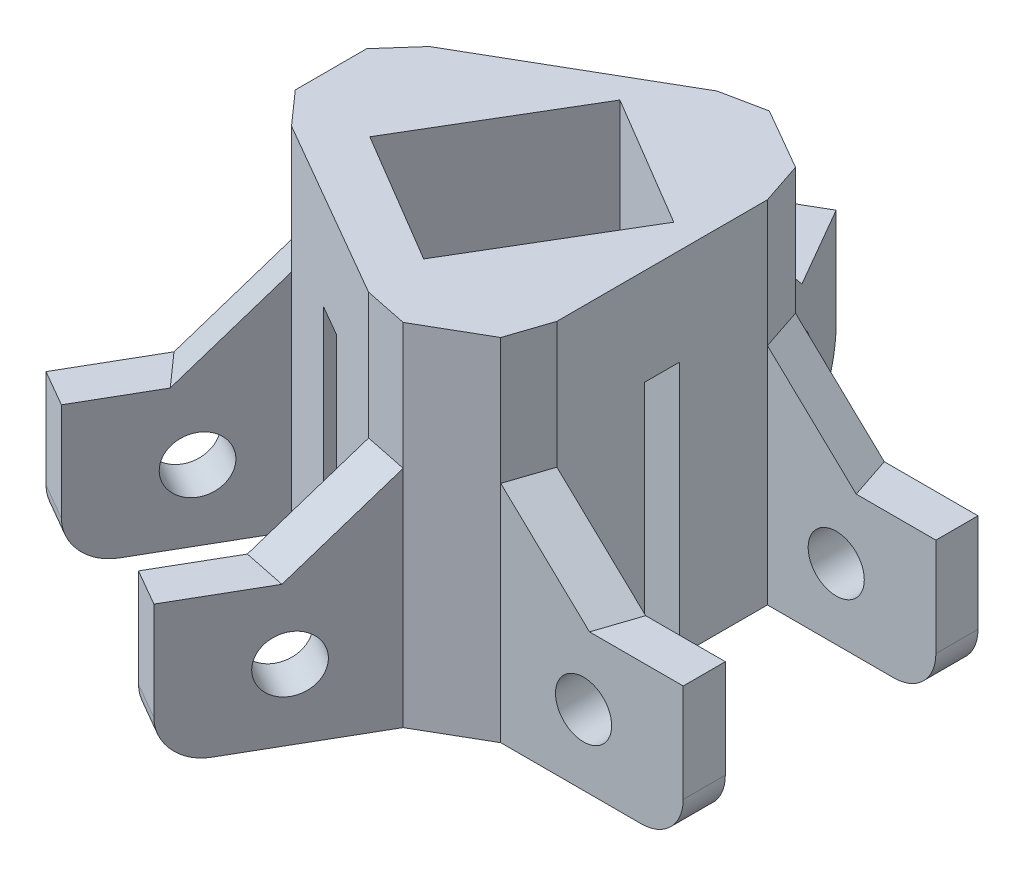
from build123d import *

# Parameters (mm, degrees)
SKETCH1_R           = 3.5
BOSS_EXTRUDE1_DEPTH = 5
SKETCH2_R           = 2
CUT_EXTRUDE1_DEPTH  = 12.5
BOSS_EXTRUDE2_DEPTH = 15
CHAMFER1_SIZE       = 6
FILLET1_R           = 3
SKETCH6_R           = 14
CUT_EXTRUDE2_DEPTH  = 1.25
CIRPATTERN1_COUNT   = 3


with BuildPart() as part:
    # Sketch1 → Boss-Extrude1 (new, symmetric)
    with BuildSketch(Plane(origin=(0, 0, 0), x_dir=(1, 0, 0), z_dir=(0, 1, 0))):
        Polygon((10, 7.5), (10, -7.5), (22, -7.5), (22, -10.5), (9, -10.5), (4.59326674, -13.044228634), (-1.90673326, -24.302558883), (-4.504809472, -22.802558883), (1.495190528, -12.410254038), (-11.495190528, -4.910254038), (-17.495190528, -15.302558883), (-20.09326674, -13.802558883), (-13.59326674, -2.544228634), (-13.59326674, 2.544228634), (-20.09326674, 13.802558883), (-17.495190528, 15.302558883), (-11.495190528, 4.910254038), (1.495190528, 12.410254038), (-4.504809472, 22.802558883), (-1.90673326, 24.302558883), (4.59326674, 13.044228634), (9, 10.5), (22, 10.5), (22, 7.5), align=None)
        with Locations(Location((0, 0, 0), (0, 0, 270))):
            Circle(SKETCH1_R, mode=Mode.SUBTRACT)
    extrude(amount=BOSS_EXTRUDE1_DEPTH, both=True)

    # Sketch2 → Cut-Extrude1 (cut, symmetric)
    with BuildSketch(Plane(origin=(6.062177826, 0, 0), x_dir=(1, 0, 0), z_dir=(0, 0, 1))):
        with Locations((8.837822174, 0)):
            Circle(SKETCH2_R)
    cut_extrude1 = extrude(amount=CUT_EXTRUDE1_DEPTH, both=True, mode=Mode.SUBTRACT)

    # Sketch5 → Boss-Extrude2 (add)
    with BuildSketch(Plane(origin=(0, 5, 0), x_dir=(1, 0, 0), z_dir=(0, 1, 0))):
        Polygon((-11.495190528, 4.910254038), (-13.59326674, 2.544228634), (-13.59326674, -2.544228634), (-11.495190528, -4.910254038), (1.495190528, -12.410254038), (4.59326674, -13.044228634), (9, -10.5), (10, -7.5), (10, 7.5), (9, 10.5), (4.59326674, 13.044228634), (1.495190528, 12.410254038), align=None)
        Polygon((-1.408058794, 8.397462142), (8.048577071, 2.778562062), (1.408058794, -8.397462142), (-8.048577071, -2.778562062), align=None, mode=Mode.SUBTRACT)
    extrude(amount=BOSS_EXTRUDE2_DEPTH)

    # Chamfer1
    # the kernel refuses this chamfer: 6 mm, written as the material it adds along each edge
    with BuildSketch(Plane(origin=(14.879425397, 5, 7.138276191), x_dir=(0.9483246169389857, -0.027495876610586355, -0.31610820564632863), z_dir=(-0.31622776601683794, 0, -0.9486832980505138))) as chamfer1_piece_1_section:
        Polygon((CHAMFER1_SIZE * 0.999621916911, -CHAMFER1_SIZE * 0.0274958766106), (-CHAMFER1_SIZE * 0.0274958766106, -CHAMFER1_SIZE * 0.999621916911), (0, 0), align=None)
    chamfer1_piece_1 = extrude(amount=34.022473516, mode=Mode.PRIVATE)
    chamfer1_piece_1 = split(chamfer1_piece_1, bisect_by=Plane(origin=(10, 7.238305373, -8.343587756), z_dir=(1, 0, 0)), keep=Keep.TOP, mode=Mode.PRIVATE)
    chamfer1_piece_1 = split(chamfer1_piece_1, bisect_by=Plane(origin=(11.214187952, 7.238305373, -7.5), z_dir=(0, 0, -1)), keep=Keep.TOP, mode=Mode.PRIVATE)
    chamfer1_piece_1 = split(chamfer1_piece_1, bisect_by=Plane(origin=(11.594394856, 7.238305373, -9.002125431), z_dir=(-0.5000000000000008, 0, 0.8660254037844383)), keep=Keep.TOP, mode=Mode.PRIVATE)
    add(chamfer1_piece_1)
    with BuildSketch(Plane(origin=(14.879425397, 5, 7.138276191), x_dir=(0.9483246169389857, -0.027495876610586355, -0.31610820564632863), z_dir=(-0.31622776601683794, 0, -0.9486832980505138))) as chamfer1_piece_2_section:
        Polygon((CHAMFER1_SIZE * 0.999621916911, -CHAMFER1_SIZE * 0.0274958766106), (-CHAMFER1_SIZE * 0.0274958766106, -CHAMFER1_SIZE * 0.999621916911), (0, 0), align=None)
    chamfer1_piece_2 = extrude(amount=34.022473516, mode=Mode.PRIVATE)
    chamfer1_piece_2 = split(chamfer1_piece_2, bisect_by=Plane(origin=(10, 8.044690519, -9.214105908), z_dir=(-1, 0, 0)), keep=Keep.TOP, mode=Mode.PRIVATE)
    chamfer1_piece_2 = split(chamfer1_piece_2, bisect_by=Plane(origin=(9.590387414, 8.044690519, -7.5), z_dir=(0, 0, -1)), keep=Keep.TOP, mode=Mode.PRIVATE)
    chamfer1_piece_2 = split(chamfer1_piece_2, bisect_by=Plane(origin=(9.590387414, 8.044690519, -10.5), z_dir=(0, 0, 1)), keep=Keep.TOP, mode=Mode.PRIVATE)
    chamfer1_piece_2 = split(chamfer1_piece_2, bisect_by=Plane(origin=(9.999599036, 8.044690519, -9.922881228), z_dir=(-0.5000000000000008, 0, 0.8660254037844383)), keep=Keep.TOP, mode=Mode.PRIVATE)
    add(chamfer1_piece_2)
    with BuildSketch(Plane(origin=(14.879425397, 5, 7.138276191), x_dir=(0.9483246169389857, -0.027495876610586355, -0.31610820564632863), z_dir=(-0.31622776601683794, 0, -0.9486832980505138))) as chamfer1_piece_3_section:
        Polygon((CHAMFER1_SIZE * 0.999621916911, -CHAMFER1_SIZE * 0.0274958766106), (-CHAMFER1_SIZE * 0.0274958766106, -CHAMFER1_SIZE * 0.999621916911), (0, 0), align=None)
    chamfer1_piece_3 = extrude(amount=34.022473516, mode=Mode.PRIVATE)
    chamfer1_piece_3 = split(chamfer1_piece_3, bisect_by=Plane(origin=(10, 6.348975917, -9.386892546), z_dir=(1, 0, 0)), keep=Keep.TOP, mode=Mode.PRIVATE)
    chamfer1_piece_3 = split(chamfer1_piece_3, bisect_by=Plane(origin=(12.707905093, 6.348975917, -7.5), z_dir=(0, 0, -1)), keep=Keep.TOP, mode=Mode.PRIVATE)
    chamfer1_piece_3 = split(chamfer1_piece_3, bisect_by=Plane(origin=(12.707905093, 6.348975917, -10.5), z_dir=(0, 0, 1)), keep=Keep.TOP, mode=Mode.PRIVATE)
    chamfer1_piece_3 = split(chamfer1_piece_3, bisect_by=Plane(origin=(12.262918486, 6.348975917, -8.616153134), z_dir=(0.5000000000000008, 0, -0.8660254037844383)), keep=Keep.TOP, mode=Mode.PRIVATE)
    add(chamfer1_piece_3)
    with BuildSketch(Plane(origin=(14.879425397, 5, 7.138276191), x_dir=(0.9483246169389857, -0.027495876610586355, -0.31610820564632863), z_dir=(-0.31622776601683794, 0, -0.9486832980505138))) as chamfer1_piece_4_section:
        Polygon((CHAMFER1_SIZE * 0.999621916911, -CHAMFER1_SIZE * 0.0274958766106), (-CHAMFER1_SIZE * 0.0274958766106, -CHAMFER1_SIZE * 0.999621916911), (0, 0), align=None)
    chamfer1_piece_4 = extrude(amount=34.022473516, mode=Mode.PRIVATE)
    chamfer1_piece_4 = split(chamfer1_piece_4, bisect_by=Plane(origin=(10, 7.664220287, -10.309273658), z_dir=(-1, 0, 0)), keep=Keep.TOP, mode=Mode.PRIVATE)
    chamfer1_piece_4 = split(chamfer1_piece_4, bisect_by=Plane(origin=(9.657905234, 7.664220287, -10.5), z_dir=(0, 0, 1)), keep=Keep.TOP, mode=Mode.PRIVATE)
    chamfer1_piece_4 = split(chamfer1_piece_4, bisect_by=Plane(origin=(9.576015854, 7.664220287, -10.167437092), z_dir=(0.5000000000000008, 0, -0.8660254037844383)), keep=Keep.TOP, mode=Mode.PRIVATE)
    add(chamfer1_piece_4)
    with BuildSketch(Plane(origin=(19.710098488, 5, -16.13766038), x_dir=(-0.20040457203505768, -0.027495876610586337, -0.9793273121264722), z_dir=(-0.979697719266168, 0, 0.2004803702726748))) as chamfer1_piece_5_section:
        Polygon((CHAMFER1_SIZE * 0.999621916911, -CHAMFER1_SIZE * 0.0274958766106), (-CHAMFER1_SIZE * 0.0274958766106, -CHAMFER1_SIZE * 0.999621916911), (0, 0), align=None)
    chamfer1_piece_5 = extrude(amount=34.022473516, mode=Mode.PRIVATE)
    chamfer1_piece_5 = split(chamfer1_piece_5, bisect_by=Plane(origin=(3.928092882, 7.664220287, -13.814890867), z_dir=(0.5000000000000004, 0, 0.8660254037844385)), keep=Keep.TOP, mode=Mode.PRIVATE)
    chamfer1_piece_5 = split(chamfer1_piece_5, bisect_by=Plane(origin=(4.264314123, 7.664220287, -13.61399128), z_dir=(-0.8660254037844384, 0, 0.5000000000000006)), keep=Keep.TOP, mode=Mode.PRIVATE)
    chamfer1_piece_5 = split(chamfer1_piece_5, bisect_by=Plane(origin=(4.017250886, 7.664220287, -13.376791542), z_dir=(0.5000000000000008, 0, -0.8660254037844383)), keep=Keep.TOP, mode=Mode.PRIVATE)
    add(chamfer1_piece_5)
    with BuildSketch(Plane(origin=(19.710098488, 5, -16.13766038), x_dir=(-0.20040457203505768, -0.027495876610586337, -0.9793273121264722), z_dir=(-0.979697719266168, 0, 0.2004803702726748))) as chamfer1_piece_6_section:
        Polygon((CHAMFER1_SIZE * 0.999621916911, -CHAMFER1_SIZE * 0.0274958766106), (-CHAMFER1_SIZE * 0.0274958766106, -CHAMFER1_SIZE * 0.999621916911), (0, 0), align=None)
    chamfer1_piece_6 = extrude(amount=34.022473516, mode=Mode.PRIVATE)
    chamfer1_piece_6 = split(chamfer1_piece_6, bisect_by=Plane(origin=(2.97964979, 8.044690519, -13.267306992), z_dir=(0.5000000000000004, 0, 0.8660254037844385)), keep=Keep.TOP, mode=Mode.PRIVATE)
    chamfer1_piece_6 = split(chamfer1_piece_6, bisect_by=Plane(origin=(1.699996821, 8.044690519, -12.055519133), z_dir=(0.8660254037844385, 0, -0.5000000000000004)), keep=Keep.TOP, mode=Mode.PRIVATE)
    chamfer1_piece_6 = split(chamfer1_piece_6, bisect_by=Plane(origin=(4.298073033, 8.044690519, -13.555519133), z_dir=(-0.8660254037844384, 0, 0.5000000000000006)), keep=Keep.TOP, mode=Mode.PRIVATE)
    chamfer1_piece_6 = split(chamfer1_piece_6, bisect_by=Plane(origin=(3.593667704, 8.044690519, -13.621347406), z_dir=(-0.5000000000000008, 0, 0.8660254037844383)), keep=Keep.TOP, mode=Mode.PRIVATE)
    add(chamfer1_piece_6)
    with BuildSketch(Plane(origin=(19.710098488, 5, -16.13766038), x_dir=(-0.20040457203505768, -0.027495876610586337, -0.9793273121264722), z_dir=(-0.979697719266168, 0, 0.2004803702726748))) as chamfer1_piece_7_section:
        Polygon((CHAMFER1_SIZE * 0.999621916911, -CHAMFER1_SIZE * 0.0274958766106), (-CHAMFER1_SIZE * 0.0274958766106, -CHAMFER1_SIZE * 0.999621916911), (0, 0), align=None)
    chamfer1_piece_7 = extrude(amount=34.022473516, mode=Mode.PRIVATE)
    chamfer1_piece_7 = split(chamfer1_piece_7, bisect_by=Plane(origin=(3.129287407, 6.348975917, -13.353700311), z_dir=(-0.5000000000000004, 0, -0.8660254037844385)), keep=Keep.TOP, mode=Mode.PRIVATE)
    chamfer1_piece_7 = split(chamfer1_piece_7, bisect_by=Plane(origin=(0.141237982, 6.348975917, -14.755368639), z_dir=(0.8660254037844385, 0, -0.5000000000000004)), keep=Keep.TOP, mode=Mode.PRIVATE)
    chamfer1_piece_7 = split(chamfer1_piece_7, bisect_by=Plane(origin=(2.739314193, 6.348975917, -16.255368639), z_dir=(-0.8660254037844384, 0, 0.5000000000000006)), keep=Keep.TOP, mode=Mode.PRIVATE)
    chamfer1_piece_7 = split(chamfer1_piece_7, bisect_by=Plane(origin=(1.330348254, 6.348975917, -14.9280755), z_dir=(0.5000000000000008, 0, -0.8660254037844383)), keep=Keep.TOP, mode=Mode.PRIVATE)
    add(chamfer1_piece_7)
    with BuildSketch(Plane(origin=(19.710098488, 5, -16.13766038), x_dir=(-0.20040457203505768, -0.027495876610586337, -0.9793273121264722), z_dir=(-0.979697719266168, 0, 0.2004803702726748))) as chamfer1_piece_8_section:
        Polygon((CHAMFER1_SIZE * 0.999621916911, -CHAMFER1_SIZE * 0.0274958766106), (-CHAMFER1_SIZE * 0.0274958766106, -CHAMFER1_SIZE * 0.999621916911), (0, 0), align=None)
    chamfer1_piece_8 = extrude(amount=34.022473516, mode=Mode.PRIVATE)
    chamfer1_piece_8 = split(chamfer1_piece_8, bisect_by=Plane(origin=(2.225758955, 7.238305373, -12.832047916), z_dir=(-0.5000000000000004, 0, -0.8660254037844385)), keep=Keep.TOP, mode=Mode.PRIVATE)
    chamfer1_piece_8 = split(chamfer1_piece_8, bisect_by=Plane(origin=(0.888096553, 7.238305373, -13.461771649), z_dir=(0.8660254037844385, 0, -0.5000000000000004)), keep=Keep.TOP, mode=Mode.PRIVATE)
    chamfer1_piece_8 = split(chamfer1_piece_8, bisect_by=Plane(origin=(1.998871884, 7.238305373, -14.542103203), z_dir=(-0.5000000000000008, 0, 0.8660254037844383)), keep=Keep.TOP, mode=Mode.PRIVATE)
    add(chamfer1_piece_8)
    with BuildSketch(Plane(origin=(-1.257784178, 5, -16.455098483), x_dir=(-0.7479200449039286, -0.027495876610586348, -0.6632191064801443), z_dir=(-0.6634699532493307, 0, 0.7482029277778397))) as chamfer1_piece_9_section:
        Polygon((CHAMFER1_SIZE * 0.999621916911, -CHAMFER1_SIZE * 0.0274958766106), (-CHAMFER1_SIZE * 0.0274958766106, -CHAMFER1_SIZE * 0.999621916911), (0, 0), align=None)
    chamfer1_piece_9 = extrude(amount=34.022473516, mode=Mode.PRIVATE)
    chamfer1_piece_9 = split(chamfer1_piece_9, bisect_by=Plane(origin=(-13.59326674, 7.238305373, -5.539977771), z_dir=(1, 0, 0)), keep=Keep.TOP, mode=Mode.PRIVATE)
    chamfer1_piece_9 = split(chamfer1_piece_9, bisect_by=Plane(origin=(-12.102284504, 7.238305373, -5.961771649), z_dir=(-0.8660254037844383, 0, 0.5000000000000007)), keep=Keep.TOP, mode=Mode.PRIVATE)
    chamfer1_piece_9 = split(chamfer1_piece_9, bisect_by=Plane(origin=(-12.225758955, 7.238305373, -4.48846016), z_dir=(-0.5000000000000004, 0, -0.8660254037844385)), keep=Keep.TOP, mode=Mode.PRIVATE)
    add(chamfer1_piece_9)
    with BuildSketch(Plane(origin=(-1.257784178, 5, -16.455098483), x_dir=(-0.7479200449039286, -0.027495876610586348, -0.6632191064801443), z_dir=(-0.6634699532493307, 0, 0.7482029277778397))) as chamfer1_piece_10_section:
        Polygon((CHAMFER1_SIZE * 0.999621916911, -CHAMFER1_SIZE * 0.0274958766106), (-CHAMFER1_SIZE * 0.0274958766106, -CHAMFER1_SIZE * 0.999621916911), (0, 0), align=None)
    chamfer1_piece_10 = extrude(amount=34.022473516, mode=Mode.PRIVATE)
    chamfer1_piece_10 = split(chamfer1_piece_10, bisect_by=Plane(origin=(-13.59326674, 8.044690519, -3.698466179), z_dir=(1, 0, 0)), keep=Keep.TOP, mode=Mode.PRIVATE)
    chamfer1_piece_10 = split(chamfer1_piece_10, bisect_by=Plane(origin=(-13.888460447, 8.044690519, -3.055519133), z_dir=(0.8660254037844386, 0, -0.5000000000000001)), keep=Keep.TOP, mode=Mode.PRIVATE)
    chamfer1_piece_10 = split(chamfer1_piece_10, bisect_by=Plane(origin=(-11.290384235, 8.044690519, -4.555519133), z_dir=(-0.8660254037844383, 0, 0.5000000000000007)), keep=Keep.TOP, mode=Mode.PRIVATE)
    chamfer1_piece_10 = split(chamfer1_piece_10, bisect_by=Plane(origin=(-12.97964979, 8.044690519, -4.053201084), z_dir=(0.5000000000000004, 0, 0.8660254037844385)), keep=Keep.TOP, mode=Mode.PRIVATE)
    add(chamfer1_piece_10)
    with BuildSketch(Plane(origin=(-1.257784178, 5, -16.455098483), x_dir=(-0.7479200449039286, -0.027495876610586348, -0.6632191064801443), z_dir=(-0.6634699532493307, 0, 0.7482029277778397))) as chamfer1_piece_11_section:
        Polygon((CHAMFER1_SIZE * 0.999621916911, -CHAMFER1_SIZE * 0.0274958766106), (-CHAMFER1_SIZE * 0.0274958766106, -CHAMFER1_SIZE * 0.999621916911), (0, 0), align=None)
    chamfer1_piece_11 = extrude(amount=34.022473516, mode=Mode.PRIVATE)
    chamfer1_piece_11 = split(chamfer1_piece_11, bisect_by=Plane(origin=(-13.59326674, 6.348975917, -6.311922367), z_dir=(-1, 0, 0)), keep=Keep.TOP, mode=Mode.PRIVATE)
    chamfer1_piece_11 = split(chamfer1_piece_11, bisect_by=Plane(origin=(-15.447219286, 6.348975917, -5.755368639), z_dir=(0.8660254037844386, 0, -0.5000000000000001)), keep=Keep.TOP, mode=Mode.PRIVATE)
    chamfer1_piece_11 = split(chamfer1_piece_11, bisect_by=Plane(origin=(-12.849143075, 6.348975917, -7.255368639), z_dir=(-0.8660254037844383, 0, 0.5000000000000007)), keep=Keep.TOP, mode=Mode.PRIVATE)
    chamfer1_piece_11 = split(chamfer1_piece_11, bisect_by=Plane(origin=(-13.129287407, 6.348975917, -3.966807765), z_dir=(-0.5000000000000004, 0, -0.8660254037844385)), keep=Keep.TOP, mode=Mode.PRIVATE)
    add(chamfer1_piece_11)
    with BuildSketch(Plane(origin=(-1.257784178, 5, -16.455098483), x_dir=(-0.7479200449039286, -0.027495876610586348, -0.6632191064801443), z_dir=(-0.6634699532493307, 0, 0.7482029277778397))) as chamfer1_piece_12_section:
        Polygon((CHAMFER1_SIZE * 0.999621916911, -CHAMFER1_SIZE * 0.0274958766106), (-CHAMFER1_SIZE * 0.0274958766106, -CHAMFER1_SIZE * 0.999621916911), (0, 0), align=None)
    chamfer1_piece_12 = extrude(amount=34.022473516, mode=Mode.PRIVATE)
    chamfer1_piece_12 = split(chamfer1_piece_12, bisect_by=Plane(origin=(-13.59326674, 7.664220287, -3.209354451), z_dir=(-1, 0, 0)), keep=Keep.TOP, mode=Mode.PRIVATE)
    chamfer1_piece_12 = split(chamfer1_piece_12, bisect_by=Plane(origin=(-13.922219357, 7.664220287, -3.11399128), z_dir=(0.8660254037844386, 0, -0.5000000000000001)), keep=Keep.TOP, mode=Mode.PRIVATE)
    chamfer1_piece_12 = split(chamfer1_piece_12, bisect_by=Plane(origin=(-13.928092882, 7.664220287, -3.505617209), z_dir=(0.5000000000000004, 0, 0.8660254037844385)), keep=Keep.TOP, mode=Mode.PRIVATE)
    add(chamfer1_piece_12)
    with BuildSketch(Plane(origin=(-23.830673091, 5, -9.000615811), x_dir=(-0.7479200449039286, -0.027495876610586348, 0.6632191064801441), z_dir=(0.6634699532493307, 0, 0.7482029277778397))) as chamfer1_piece_13_section:
        Polygon((CHAMFER1_SIZE * 0.999621916911, -CHAMFER1_SIZE * 0.0274958766106), (-CHAMFER1_SIZE * 0.0274958766106, -CHAMFER1_SIZE * 0.999621916911), (0, 0), align=None)
    chamfer1_piece_13 = extrude(amount=34.022473516, mode=Mode.PRIVATE)
    chamfer1_piece_13 = split(chamfer1_piece_13, bisect_by=Plane(origin=(-13.928092882, 7.664220287, 3.505617209), z_dir=(0.4999999999999998, 0, -0.8660254037844388)), keep=Keep.TOP, mode=Mode.PRIVATE)
    chamfer1_piece_13 = split(chamfer1_piece_13, bisect_by=Plane(origin=(-13.922219357, 7.664220287, 3.11399128), z_dir=(0.8660254037844388, 0, 0.49999999999999983)), keep=Keep.TOP, mode=Mode.PRIVATE)
    chamfer1_piece_13 = split(chamfer1_piece_13, bisect_by=Plane(origin=(-13.59326674, 7.664220287, 3.209354451), z_dir=(-1, 0, 0)), keep=Keep.TOP, mode=Mode.PRIVATE)
    add(chamfer1_piece_13)
    with BuildSketch(Plane(origin=(-23.830673091, 5, -9.000615811), x_dir=(-0.7479200449039286, -0.027495876610586348, 0.6632191064801441), z_dir=(0.6634699532493307, 0, 0.7482029277778397))) as chamfer1_piece_14_section:
        Polygon((CHAMFER1_SIZE * 0.999621916911, -CHAMFER1_SIZE * 0.0274958766106), (-CHAMFER1_SIZE * 0.0274958766106, -CHAMFER1_SIZE * 0.999621916911), (0, 0), align=None)
    chamfer1_piece_14 = extrude(amount=34.022473516, mode=Mode.PRIVATE)
    chamfer1_piece_14 = split(chamfer1_piece_14, bisect_by=Plane(origin=(-12.97964979, 8.044690519, 4.053201084), z_dir=(0.4999999999999998, 0, -0.8660254037844388)), keep=Keep.TOP, mode=Mode.PRIVATE)
    chamfer1_piece_14 = split(chamfer1_piece_14, bisect_by=Plane(origin=(-11.290384235, 8.044690519, 4.555519133), z_dir=(-0.8660254037844388, 0, -0.4999999999999999)), keep=Keep.TOP, mode=Mode.PRIVATE)
    chamfer1_piece_14 = split(chamfer1_piece_14, bisect_by=Plane(origin=(-13.888460447, 8.044690519, 3.055519133), z_dir=(0.8660254037844388, 0, 0.49999999999999983)), keep=Keep.TOP, mode=Mode.PRIVATE)
    chamfer1_piece_14 = split(chamfer1_piece_14, bisect_by=Plane(origin=(-13.59326674, 8.044690519, 3.698466179), z_dir=(1, 0, 0)), keep=Keep.TOP, mode=Mode.PRIVATE)
    add(chamfer1_piece_14)
    with BuildSketch(Plane(origin=(-23.830673091, 5, -9.000615811), x_dir=(-0.7479200449039286, -0.027495876610586348, 0.6632191064801441), z_dir=(0.6634699532493307, 0, 0.7482029277778397))) as chamfer1_piece_15_section:
        Polygon((CHAMFER1_SIZE * 0.999621916911, -CHAMFER1_SIZE * 0.0274958766106), (-CHAMFER1_SIZE * 0.0274958766106, -CHAMFER1_SIZE * 0.999621916911), (0, 0), align=None)
    chamfer1_piece_15 = extrude(amount=34.022473516, mode=Mode.PRIVATE)
    chamfer1_piece_15 = split(chamfer1_piece_15, bisect_by=Plane(origin=(-13.129287407, 6.348975917, 3.966807765), z_dir=(-0.4999999999999998, 0, 0.8660254037844388)), keep=Keep.TOP, mode=Mode.PRIVATE)
    chamfer1_piece_15 = split(chamfer1_piece_15, bisect_by=Plane(origin=(-12.849143075, 6.348975917, 7.255368639), z_dir=(-0.8660254037844388, 0, -0.4999999999999999)), keep=Keep.TOP, mode=Mode.PRIVATE)
    chamfer1_piece_15 = split(chamfer1_piece_15, bisect_by=Plane(origin=(-15.447219286, 6.348975917, 5.755368639), z_dir=(0.8660254037844388, 0, 0.49999999999999983)), keep=Keep.TOP, mode=Mode.PRIVATE)
    chamfer1_piece_15 = split(chamfer1_piece_15, bisect_by=Plane(origin=(-13.59326674, 6.348975917, 6.311922367), z_dir=(-1, 0, 0)), keep=Keep.TOP, mode=Mode.PRIVATE)
    add(chamfer1_piece_15)
    with BuildSketch(Plane(origin=(-23.830673091, 5, -9.000615811), x_dir=(-0.7479200449039286, -0.027495876610586348, 0.6632191064801441), z_dir=(0.6634699532493307, 0, 0.7482029277778397))) as chamfer1_piece_16_section:
        Polygon((CHAMFER1_SIZE * 0.999621916911, -CHAMFER1_SIZE * 0.0274958766106), (-CHAMFER1_SIZE * 0.0274958766106, -CHAMFER1_SIZE * 0.999621916911), (0, 0), align=None)
    chamfer1_piece_16 = extrude(amount=34.022473516, mode=Mode.PRIVATE)
    chamfer1_piece_16 = split(chamfer1_piece_16, bisect_by=Plane(origin=(-12.225758955, 7.238305373, 4.48846016), z_dir=(-0.4999999999999998, 0, 0.8660254037844388)), keep=Keep.TOP, mode=Mode.PRIVATE)
    chamfer1_piece_16 = split(chamfer1_piece_16, bisect_by=Plane(origin=(-12.102284504, 7.238305373, 5.961771649), z_dir=(-0.8660254037844388, 0, -0.4999999999999999)), keep=Keep.TOP, mode=Mode.PRIVATE)
    chamfer1_piece_16 = split(chamfer1_piece_16, bisect_by=Plane(origin=(-13.59326674, 7.238305373, 5.539977771), z_dir=(1, 0, 0)), keep=Keep.TOP, mode=Mode.PRIVATE)
    add(chamfer1_piece_16)
    with BuildSketch(Plane(origin=(-13.62164122, 5, 9.316822292), x_dir=(-0.20040457203505713, -0.02749587661058635, 0.9793273121264724), z_dir=(0.9796977192661681, 0, 0.2004803702726742))) as chamfer1_piece_17_section:
        Polygon((CHAMFER1_SIZE * 0.999621916911, -CHAMFER1_SIZE * 0.0274958766106), (-CHAMFER1_SIZE * 0.0274958766106, -CHAMFER1_SIZE * 0.999621916911), (0, 0), align=None)
    chamfer1_piece_17 = extrude(amount=34.022473516, mode=Mode.PRIVATE)
    chamfer1_piece_17 = split(chamfer1_piece_17, bisect_by=Plane(origin=(1.998871884, 7.238305373, 14.542103203), z_dir=(-0.5000000000000007, 0, -0.8660254037844384)), keep=Keep.TOP, mode=Mode.PRIVATE)
    chamfer1_piece_17 = split(chamfer1_piece_17, bisect_by=Plane(origin=(0.888096553, 7.238305373, 13.461771649), z_dir=(0.8660254037844388, 0, 0.49999999999999983)), keep=Keep.TOP, mode=Mode.PRIVATE)
    chamfer1_piece_17 = split(chamfer1_piece_17, bisect_by=Plane(origin=(2.225758955, 7.238305373, 12.832047916), z_dir=(-0.4999999999999998, 0, 0.8660254037844388)), keep=Keep.TOP, mode=Mode.PRIVATE)
    add(chamfer1_piece_17)
    with BuildSketch(Plane(origin=(-13.62164122, 5, 9.316822292), x_dir=(-0.20040457203505713, -0.02749587661058635, 0.9793273121264724), z_dir=(0.9796977192661681, 0, 0.2004803702726742))) as chamfer1_piece_18_section:
        Polygon((CHAMFER1_SIZE * 0.999621916911, -CHAMFER1_SIZE * 0.0274958766106), (-CHAMFER1_SIZE * 0.0274958766106, -CHAMFER1_SIZE * 0.999621916911), (0, 0), align=None)
    chamfer1_piece_18 = extrude(amount=34.022473516, mode=Mode.PRIVATE)
    chamfer1_piece_18 = split(chamfer1_piece_18, bisect_by=Plane(origin=(3.593667704, 8.044690519, 13.621347406), z_dir=(-0.5000000000000007, 0, -0.8660254037844384)), keep=Keep.TOP, mode=Mode.PRIVATE)
    chamfer1_piece_18 = split(chamfer1_piece_18, bisect_by=Plane(origin=(4.298073033, 8.044690519, 13.555519133), z_dir=(-0.8660254037844388, 0, -0.49999999999999983)), keep=Keep.TOP, mode=Mode.PRIVATE)
    chamfer1_piece_18 = split(chamfer1_piece_18, bisect_by=Plane(origin=(1.699996821, 8.044690519, 12.055519133), z_dir=(0.8660254037844388, 0, 0.49999999999999983)), keep=Keep.TOP, mode=Mode.PRIVATE)
    chamfer1_piece_18 = split(chamfer1_piece_18, bisect_by=Plane(origin=(2.97964979, 8.044690519, 13.267306992), z_dir=(0.4999999999999998, 0, -0.8660254037844388)), keep=Keep.TOP, mode=Mode.PRIVATE)
    add(chamfer1_piece_18)
    with BuildSketch(Plane(origin=(-13.62164122, 5, 9.316822292), x_dir=(-0.20040457203505713, -0.02749587661058635, 0.9793273121264724), z_dir=(0.9796977192661681, 0, 0.2004803702726742))) as chamfer1_piece_19_section:
        Polygon((CHAMFER1_SIZE * 0.999621916911, -CHAMFER1_SIZE * 0.0274958766106), (-CHAMFER1_SIZE * 0.0274958766106, -CHAMFER1_SIZE * 0.999621916911), (0, 0), align=None)
    chamfer1_piece_19 = extrude(amount=34.022473516, mode=Mode.PRIVATE)
    chamfer1_piece_19 = split(chamfer1_piece_19, bisect_by=Plane(origin=(1.330348254, 6.348975917, 14.9280755), z_dir=(0.5000000000000007, 0, 0.8660254037844384)), keep=Keep.TOP, mode=Mode.PRIVATE)
    chamfer1_piece_19 = split(chamfer1_piece_19, bisect_by=Plane(origin=(2.739314193, 6.348975917, 16.255368639), z_dir=(-0.8660254037844388, 0, -0.49999999999999983)), keep=Keep.TOP, mode=Mode.PRIVATE)
    chamfer1_piece_19 = split(chamfer1_piece_19, bisect_by=Plane(origin=(0.141237982, 6.348975917, 14.755368639), z_dir=(0.8660254037844388, 0, 0.49999999999999983)), keep=Keep.TOP, mode=Mode.PRIVATE)
    chamfer1_piece_19 = split(chamfer1_piece_19, bisect_by=Plane(origin=(3.129287407, 6.348975917, 13.353700311), z_dir=(-0.4999999999999998, 0, 0.8660254037844388)), keep=Keep.TOP, mode=Mode.PRIVATE)
    add(chamfer1_piece_19)
    with BuildSketch(Plane(origin=(-13.62164122, 5, 9.316822292), x_dir=(-0.20040457203505713, -0.02749587661058635, 0.9793273121264724), z_dir=(0.9796977192661681, 0, 0.2004803702726742))) as chamfer1_piece_20_section:
        Polygon((CHAMFER1_SIZE * 0.999621916911, -CHAMFER1_SIZE * 0.0274958766106), (-CHAMFER1_SIZE * 0.0274958766106, -CHAMFER1_SIZE * 0.999621916911), (0, 0), align=None)
    chamfer1_piece_20 = extrude(amount=34.022473516, mode=Mode.PRIVATE)
    chamfer1_piece_20 = split(chamfer1_piece_20, bisect_by=Plane(origin=(4.017250886, 7.664220287, 13.376791542), z_dir=(0.5000000000000007, 0, 0.8660254037844384)), keep=Keep.TOP, mode=Mode.PRIVATE)
    chamfer1_piece_20 = split(chamfer1_piece_20, bisect_by=Plane(origin=(4.264314123, 7.664220287, 13.61399128), z_dir=(-0.8660254037844388, 0, -0.49999999999999983)), keep=Keep.TOP, mode=Mode.PRIVATE)
    chamfer1_piece_20 = split(chamfer1_piece_20, bisect_by=Plane(origin=(3.928092882, 7.664220287, 13.814890867), z_dir=(0.4999999999999998, 0, -0.8660254037844388)), keep=Keep.TOP, mode=Mode.PRIVATE)
    add(chamfer1_piece_20)
    with BuildSketch(Plane(origin=(4.120574603, 5, 25.138276191), x_dir=(0.9483246169389855, -0.027495876610586348, 0.316108205646329), z_dir=(0.31622776601683844, 0, -0.9486832980505137))) as chamfer1_piece_21_section:
        Polygon((CHAMFER1_SIZE * 0.999621916911, -CHAMFER1_SIZE * 0.0274958766106), (-CHAMFER1_SIZE * 0.0274958766106, -CHAMFER1_SIZE * 0.999621916911), (0, 0), align=None)
    chamfer1_piece_21 = extrude(amount=34.022473516, mode=Mode.PRIVATE)
    chamfer1_piece_21 = split(chamfer1_piece_21, bisect_by=Plane(origin=(10, 7.664220287, 10.309273658), z_dir=(-1, 0, 0)), keep=Keep.TOP, mode=Mode.PRIVATE)
    chamfer1_piece_21 = split(chamfer1_piece_21, bisect_by=Plane(origin=(9.657905234, 7.664220287, 10.5), z_dir=(0, 0, -1)), keep=Keep.TOP, mode=Mode.PRIVATE)
    chamfer1_piece_21 = split(chamfer1_piece_21, bisect_by=Plane(origin=(9.576015854, 7.664220287, 10.167437092), z_dir=(0.5000000000000007, 0, 0.8660254037844384)), keep=Keep.TOP, mode=Mode.PRIVATE)
    add(chamfer1_piece_21)
    with BuildSketch(Plane(origin=(4.120574603, 5, 25.138276191), x_dir=(0.9483246169389855, -0.027495876610586348, 0.316108205646329), z_dir=(0.31622776601683844, 0, -0.9486832980505137))) as chamfer1_piece_22_section:
        Polygon((CHAMFER1_SIZE * 0.999621916911, -CHAMFER1_SIZE * 0.0274958766106), (-CHAMFER1_SIZE * 0.0274958766106, -CHAMFER1_SIZE * 0.999621916911), (0, 0), align=None)
    chamfer1_piece_22 = extrude(amount=34.022473516, mode=Mode.PRIVATE)
    chamfer1_piece_22 = split(chamfer1_piece_22, bisect_by=Plane(origin=(10, 8.044690519, 9.214105908), z_dir=(-1, 0, 0)), keep=Keep.TOP, mode=Mode.PRIVATE)
    chamfer1_piece_22 = split(chamfer1_piece_22, bisect_by=Plane(origin=(9.590387414, 8.044690519, 7.5), z_dir=(0, 0, 1)), keep=Keep.TOP, mode=Mode.PRIVATE)
    chamfer1_piece_22 = split(chamfer1_piece_22, bisect_by=Plane(origin=(9.590387414, 8.044690519, 10.5), z_dir=(0, 0, -1)), keep=Keep.TOP, mode=Mode.PRIVATE)
    chamfer1_piece_22 = split(chamfer1_piece_22, bisect_by=Plane(origin=(9.999599036, 8.044690519, 9.922881228), z_dir=(-0.5000000000000007, 0, -0.8660254037844384)), keep=Keep.TOP, mode=Mode.PRIVATE)
    add(chamfer1_piece_22)
    with BuildSketch(Plane(origin=(4.120574603, 5, 25.138276191), x_dir=(0.9483246169389855, -0.027495876610586348, 0.316108205646329), z_dir=(0.31622776601683844, 0, -0.9486832980505137))) as chamfer1_piece_23_section:
        Polygon((CHAMFER1_SIZE * 0.999621916911, -CHAMFER1_SIZE * 0.0274958766106), (-CHAMFER1_SIZE * 0.0274958766106, -CHAMFER1_SIZE * 0.999621916911), (0, 0), align=None)
    chamfer1_piece_23 = extrude(amount=34.022473516, mode=Mode.PRIVATE)
    chamfer1_piece_23 = split(chamfer1_piece_23, bisect_by=Plane(origin=(10, 6.348975917, 9.386892546), z_dir=(1, 0, 0)), keep=Keep.TOP, mode=Mode.PRIVATE)
    chamfer1_piece_23 = split(chamfer1_piece_23, bisect_by=Plane(origin=(12.707905093, 6.348975917, 7.5), z_dir=(0, 0, 1)), keep=Keep.TOP, mode=Mode.PRIVATE)
    chamfer1_piece_23 = split(chamfer1_piece_23, bisect_by=Plane(origin=(12.707905093, 6.348975917, 10.5), z_dir=(0, 0, -1)), keep=Keep.TOP, mode=Mode.PRIVATE)
    chamfer1_piece_23 = split(chamfer1_piece_23, bisect_by=Plane(origin=(12.262918486, 6.348975917, 8.616153134), z_dir=(0.5000000000000007, 0, 0.8660254037844384)), keep=Keep.TOP, mode=Mode.PRIVATE)
    add(chamfer1_piece_23)
    with BuildSketch(Plane(origin=(4.120574603, 5, 25.138276191), x_dir=(0.9483246169389855, -0.027495876610586348, 0.316108205646329), z_dir=(0.31622776601683844, 0, -0.9486832980505137))) as chamfer1_piece_24_section:
        Polygon((CHAMFER1_SIZE * 0.999621916911, -CHAMFER1_SIZE * 0.0274958766106), (-CHAMFER1_SIZE * 0.0274958766106, -CHAMFER1_SIZE * 0.999621916911), (0, 0), align=None)
    chamfer1_piece_24 = extrude(amount=34.022473516, mode=Mode.PRIVATE)
    chamfer1_piece_24 = split(chamfer1_piece_24, bisect_by=Plane(origin=(10, 7.238305373, 8.343587756), z_dir=(1, 0, 0)), keep=Keep.TOP, mode=Mode.PRIVATE)
    chamfer1_piece_24 = split(chamfer1_piece_24, bisect_by=Plane(origin=(11.214187952, 7.238305373, 7.5), z_dir=(0, 0, 1)), keep=Keep.TOP, mode=Mode.PRIVATE)
    chamfer1_piece_24 = split(chamfer1_piece_24, bisect_by=Plane(origin=(11.594394856, 7.238305373, 9.002125431), z_dir=(-0.5000000000000007, 0, -0.8660254037844384)), keep=Keep.TOP, mode=Mode.PRIVATE)
    add(chamfer1_piece_24)

    # Fillet1
    fillet1_edges = [part.edges().sort_by_distance(p)[0] for p in [
        (-3.205771366, -5, 23.552558883),
        (-18.794228634, -5, 14.552558883),
        (-18.794228634, -5, -14.552558883),
        (-3.205771366, -5, -23.552558883),
        (22, -5, -9),
        (22, -5, 9),
    ]]
    fillet(fillet1_edges, radius=FILLET1_R)

    # Sketch6 → Cut-Extrude2 (cut, symmetric)
    with BuildSketch(Plane.XY):
        with Locations((14.9, 0)):
            Circle(SKETCH6_R)
    cut_extrude2 = extrude(amount=CUT_EXTRUDE2_DEPTH, both=True, mode=Mode.SUBTRACT)

    # CirPattern1: Cut-Extrude1, Cut-Extrude2 ×3 about axis
    cirpattern1_axis = Axis((0, 0, 0), (0, 1, 0))
    add([cut_extrude1.rotate(cirpattern1_axis, i * 360 / CIRPATTERN1_COUNT) for i in range(1, CIRPATTERN1_COUNT)], mode=Mode.SUBTRACT)
    add([cut_extrude2.rotate(cirpattern1_axis, i * 360 / CIRPATTERN1_COUNT) for i in range(1, CIRPATTERN1_COUNT)], mode=Mode.SUBTRACT)


solid = part.part
